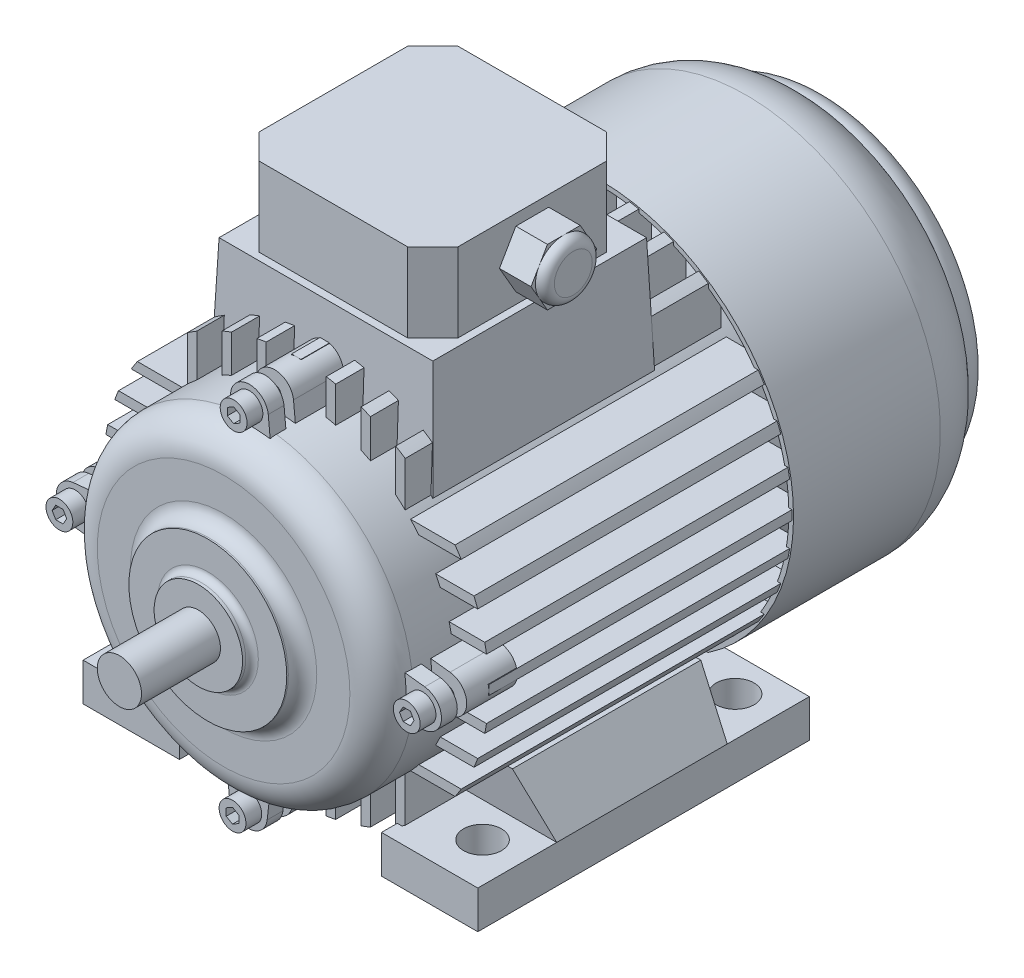
from build123d import *

# Parameters (mm, degrees)
BOSS_EXTRUDE1_DEPTH          = 50
BOSS_EXTRUDE2_DEPTH          = 5
SKETCH4_R                    = 4.25
BOSS_EXTRUDE3_DEPTH          = 5
CUT_EXTRUDE1_DEPTH           = 4
SKETCH6_R                    = 2
BOSS_EXTRUDE4_DEPTH          = 3
BOSS_EXTRUDE6_DEPTH          = 16
CIRPATTERN1_COUNT            = 4
SKETCH10_W                   = 7.5
SKETCH10_H                   = 7.5
CUT_EXTRUDE2_DEPTH           = 2
LPATTERN1_COUNT              = 4
LPATTERN1_PITCH              = 10
LPATTERN1_COUNT_DIR2         = 4
LPATTERN1_PITCH_DIR2         = 10
CIRPATTERN2_COPY_1_SKETCH_W  = 7.5
CIRPATTERN2_COPY_1_SKETCH_H  = 7.5
CIRPATTERN2_COPY_1_DEPTH     = 2
CIRPATTERN2_COPY_2_SKETCH_W  = 7.5
CIRPATTERN2_COPY_2_SKETCH_H  = 7.5
CIRPATTERN2_COPY_2_DEPTH     = 2
CIRPATTERN2_COPY_3_SKETCH_W  = 7.5
CIRPATTERN2_COPY_3_SKETCH_H  = 7.5
CIRPATTERN2_COPY_3_DEPTH     = 2
CIRPATTERN2_COPY_4_SKETCH_W  = 7.5
CIRPATTERN2_COPY_4_SKETCH_H  = 7.5
CIRPATTERN2_COPY_4_DEPTH     = 2
CIRPATTERN2_COPY_5_SKETCH_W  = 7.5
CIRPATTERN2_COPY_5_SKETCH_H  = 7.5
CIRPATTERN2_COPY_5_DEPTH     = 2
CIRPATTERN2_COPY_6_SKETCH_W  = 7.5
CIRPATTERN2_COPY_6_SKETCH_H  = 7.5
CIRPATTERN2_COPY_6_DEPTH     = 2
CIRPATTERN2_COPY_7_SKETCH_W  = 7.5
CIRPATTERN2_COPY_7_SKETCH_H  = 7.5
CIRPATTERN2_COPY_7_DEPTH     = 2
CIRPATTERN2_COPY_8_SKETCH_W  = 7.5
CIRPATTERN2_COPY_8_SKETCH_H  = 7.5
CIRPATTERN2_COPY_8_DEPTH     = 2
CIRPATTERN2_COPY_9_SKETCH_W  = 7.5
CIRPATTERN2_COPY_9_SKETCH_H  = 7.5
CIRPATTERN2_COPY_9_DEPTH     = 2
CIRPATTERN2_COPY_10_SKETCH_W = 7.5
CIRPATTERN2_COPY_10_SKETCH_H = 7.5
CIRPATTERN2_COPY_10_DEPTH    = 2
CIRPATTERN2_COPY_11_SKETCH_W = 7.5
CIRPATTERN2_COPY_11_SKETCH_H = 7.5
CIRPATTERN2_COPY_11_DEPTH    = 2
CIRPATTERN2_COPY_12_SKETCH_W = 7.5
CIRPATTERN2_COPY_12_SKETCH_H = 7.5
CIRPATTERN2_COPY_12_DEPTH    = 2
CIRPATTERN2_COPY_13_SKETCH_W = 7.5
CIRPATTERN2_COPY_13_SKETCH_H = 7.5
CIRPATTERN2_COPY_13_DEPTH    = 2
CIRPATTERN2_COPY_14_SKETCH_W = 7.5
CIRPATTERN2_COPY_14_SKETCH_H = 7.5
CIRPATTERN2_COPY_14_DEPTH    = 2
CIRPATTERN2_COPY_15_SKETCH_W = 7.5
CIRPATTERN2_COPY_15_SKETCH_H = 7.5
CIRPATTERN2_COPY_15_DEPTH    = 2
CIRPATTERN2_COPY_16_SKETCH_W = 7.5
CIRPATTERN2_COPY_16_SKETCH_H = 7.5
CIRPATTERN2_COPY_16_DEPTH    = 2
CIRPATTERN2_COPY_17_SKETCH_W = 7.5
CIRPATTERN2_COPY_17_SKETCH_H = 7.5
CIRPATTERN2_COPY_17_DEPTH    = 2
CIRPATTERN2_COPY_18_SKETCH_W = 7.5
CIRPATTERN2_COPY_18_SKETCH_H = 7.5
CIRPATTERN2_COPY_18_DEPTH    = 2
CIRPATTERN2_COPY_19_SKETCH_W = 7.5
CIRPATTERN2_COPY_19_SKETCH_H = 7.5
CIRPATTERN2_COPY_19_DEPTH    = 2
CIRPATTERN2_COPY_20_SKETCH_W = 7.5
CIRPATTERN2_COPY_20_SKETCH_H = 7.5
CIRPATTERN2_COPY_20_DEPTH    = 2
CIRPATTERN2_COPY_21_SKETCH_W = 7.5
CIRPATTERN2_COPY_21_SKETCH_H = 7.5
CIRPATTERN2_COPY_21_DEPTH    = 2
CIRPATTERN2_COPY_22_SKETCH_W = 7.5
CIRPATTERN2_COPY_22_SKETCH_H = 7.5
CIRPATTERN2_COPY_22_DEPTH    = 2
CIRPATTERN2_COPY_23_SKETCH_W = 7.5
CIRPATTERN2_COPY_23_SKETCH_H = 7.5
CIRPATTERN2_COPY_23_DEPTH    = 2
CIRPATTERN2_COPY_24_SKETCH_W = 7.5
CIRPATTERN2_COPY_24_SKETCH_H = 7.5
CIRPATTERN2_COPY_24_DEPTH    = 2
CIRPATTERN2_COPY_25_SKETCH_W = 7.5
CIRPATTERN2_COPY_25_SKETCH_H = 7.5
CIRPATTERN2_COPY_25_DEPTH    = 2
CIRPATTERN2_COPY_26_SKETCH_W = 7.5
CIRPATTERN2_COPY_26_SKETCH_H = 7.5
CIRPATTERN2_COPY_26_DEPTH    = 2
CIRPATTERN2_COPY_27_SKETCH_W = 7.5
CIRPATTERN2_COPY_27_SKETCH_H = 7.5
CIRPATTERN2_COPY_27_DEPTH    = 2
CIRPATTERN2_COPY_28_SKETCH_W = 7.5
CIRPATTERN2_COPY_28_SKETCH_H = 7.5
CIRPATTERN2_COPY_28_DEPTH    = 2
CIRPATTERN2_COPY_29_SKETCH_W = 7.5
CIRPATTERN2_COPY_29_SKETCH_H = 7.5
CIRPATTERN2_COPY_29_DEPTH    = 2
CIRPATTERN2_COPY_30_SKETCH_W = 7.5
CIRPATTERN2_COPY_30_SKETCH_H = 7.5
CIRPATTERN2_COPY_30_DEPTH    = 2
CIRPATTERN2_COPY_31_SKETCH_W = 7.5
CIRPATTERN2_COPY_31_SKETCH_H = 7.5
CIRPATTERN2_COPY_31_DEPTH    = 2
CIRPATTERN2_COPY_32_SKETCH_W = 7.5
CIRPATTERN2_COPY_32_SKETCH_H = 7.5
CIRPATTERN2_COPY_32_DEPTH    = 2
CIRPATTERN2_COPY_33_SKETCH_W = 7.5
CIRPATTERN2_COPY_33_SKETCH_H = 7.5
CIRPATTERN2_COPY_33_DEPTH    = 2
CIRPATTERN2_COPY_34_SKETCH_W = 7.5
CIRPATTERN2_COPY_34_SKETCH_H = 7.5
CIRPATTERN2_COPY_34_DEPTH    = 2
CIRPATTERN2_COPY_35_SKETCH_W = 7.5
CIRPATTERN2_COPY_35_SKETCH_H = 7.5
CIRPATTERN2_COPY_35_DEPTH    = 2
CIRPATTERN2_COPY_36_SKETCH_W = 7.5
CIRPATTERN2_COPY_36_SKETCH_H = 7.5
CIRPATTERN2_COPY_36_DEPTH    = 2
CIRPATTERN2_COPY_37_SKETCH_W = 7.5
CIRPATTERN2_COPY_37_SKETCH_H = 7.5
CIRPATTERN2_COPY_37_DEPTH    = 2
CIRPATTERN2_COPY_38_SKETCH_W = 7.5
CIRPATTERN2_COPY_38_SKETCH_H = 7.5
CIRPATTERN2_COPY_38_DEPTH    = 2
CIRPATTERN2_COPY_39_SKETCH_W = 7.5
CIRPATTERN2_COPY_39_SKETCH_H = 7.5
CIRPATTERN2_COPY_39_DEPTH    = 2
CIRPATTERN2_COPY_40_SKETCH_W = 7.5
CIRPATTERN2_COPY_40_SKETCH_H = 7.5
CIRPATTERN2_COPY_40_DEPTH    = 2
CIRPATTERN2_COPY_41_SKETCH_W = 7.5
CIRPATTERN2_COPY_41_SKETCH_H = 7.5
CIRPATTERN2_COPY_41_DEPTH    = 2
CIRPATTERN2_COPY_42_SKETCH_W = 7.5
CIRPATTERN2_COPY_42_SKETCH_H = 7.5
CIRPATTERN2_COPY_42_DEPTH    = 2
CIRPATTERN2_COPY_43_SKETCH_W = 7.5
CIRPATTERN2_COPY_43_SKETCH_H = 7.5
CIRPATTERN2_COPY_43_DEPTH    = 2
CIRPATTERN2_COPY_44_SKETCH_W = 7.5
CIRPATTERN2_COPY_44_SKETCH_H = 7.5
CIRPATTERN2_COPY_44_DEPTH    = 2
CIRPATTERN2_COPY_45_SKETCH_W = 7.5
CIRPATTERN2_COPY_45_SKETCH_H = 7.5
CIRPATTERN2_COPY_45_DEPTH    = 2
SKETCH11_W                   = 30
SKETCH11_H                   = 54
BOSS_EXTRUDE7_DEPTH          = 16
DRAFT1_ANGLE                 = -35
DRAFT2_ANGLE                 = 10
SKETCH12_W                   = 30.5
SKETCH12_H                   = 27
BOSS_EXTRUDE8_DEPTH          = 12
SKETCH13_W                   = 4
SKETCH13_H                   = 51
BOSS_EXTRUDE9_DEPTH          = 12
SKETCH14_R                   = 6
CUT_EXTRUDE3_DEPTH           = 12
SKETCH15_W                   = 70.5
SKETCH15_H                   = 70.5
BOSS_EXTRUDE10_DEPTH         = 40.23
BOSS_EXTRUDE10_TAPER         = 2
BOSS_EXTRUDE11_DEPTH         = 25
BOSS_EXTRUDE12_DEPTH         = 10
SKETCH18_R                   = 9
BOSS_EXTRUDE13_DEPTH         = 3
FILLET1_R                    = 3
BOSS_EXTRUDE14_START         = 50
SKETCH22_R                   = 7
BOSS_EXTRUDE14_DEPTH         = 50


with BuildPart() as part:
    # Sketch1 → Revolve1 (revolve)
    with BuildSketch(Plane(origin=(0, 0, 0), x_dir=(0, 0, -1), z_dir=(1, 0, 0)), mode=Mode.PRIVATE) as revolve1_sk:
        with BuildLine():
            Line((0, 7), (0, 14))
            Line((0, 14), (1, 14))
            ThreePointArc((1, 14), (2.414213562, 14.585786438), (3, 16))
            Line((3, 16), (3, 25))
            Line((3, 25), (3.5, 25))
            ThreePointArc((3.5, 25), (6.681980515, 26.318019485), (8, 29.5))
            Line((8, 29.5), (8, 40))
            ThreePointArc((8, 40), (10.928932188, 47.071067812), (18, 50))
            Line((18, 50), (142, 50))
            ThreePointArc((142, 50), (149.071067812, 47.071067812), (152, 40))
            Line((152, 40), (152, 0))
            Line((152, 0), (25, 0))
            Line((25, 0), (25, 7))
            Line((25, 7), (0, 7))
        make_face()
    revolve(revolve1_sk.sketch.rotate(Axis((0, 0, 0), (0, 0, -1)), 90), axis=Axis((0, 0, 0), (0, 0, -1)))

    # Sketch2 → Boss-Extrude1 (add, symmetric)
    with BuildSketch(Plane(origin=(0, 0, -81), x_dir=(-1, 0, 0), z_dir=(0, 0, -1))):
        with BuildLine():
            Line((-60.981554588, -1.5), (-49.977494935, -1.5))
            ThreePointArc((-49.977494935, -1.5), (-50, 0), (-49.977494935, 1.5))
            Line((-49.977494935, 1.5), (-60.981554588, 1.5))
            ThreePointArc((-60.981554588, 1.5), (-61, 0), (-60.981554588, -1.5))
        make_face()
        with BuildLine():
            Line((-60.255705124, 9.5), (-49.089204516, 9.5))
            ThreePointArc((-49.089204516, 9.5), (-48.773819281, 11.005205709), (-48.412291828, 12.5))
            Line((-48.412291828, 12.5), (-59.705527382, 12.5))
            ThreePointArc((-59.705527382, 12.5), (-59.999369381, 11.003439184), (-60.255705124, 9.5))
        make_face()
        with BuildLine():
            Line((-57.452154007, 20.5), (-45.604276115, 20.5))
            ThreePointArc((-45.604276115, 20.5), (-44.893864532, 22.012290372), (-44.133320745, 23.5))
            Line((-44.133320745, 23.5), (-56.291651246, 23.5))
            ThreePointArc((-56.291651246, 23.5), (-56.891680484, 22.007650753), (-57.452154007, 20.5))
        make_face()
        with BuildLine():
            Line((-52.237438681, 31.5), (-38.829756631, 31.5))
            ThreePointArc((-38.829756631, 31.5), (-37.540092426, 33.026375227), (-36.190468358, 34.5))
            Line((-36.190468358, 34.5), (-50.306560208, 34.5))
            ThreePointArc((-50.306560208, 34.5), (-51.293936553, 33.014119296), (-52.237438681, 31.5))
        make_face()
        with BuildLine():
            Line((-50.306560208, -34.5), (-36.190468358, -34.5))
            ThreePointArc((-36.190468358, -34.5), (-37.540092426, -33.026375227), (-38.829756631, -31.5))
            Line((-38.829756631, -31.5), (-52.237438681, -31.5))
            ThreePointArc((-52.237438681, -31.5), (-51.293936553, -33.014119296), (-50.306560208, -34.5))
        make_face()
        with BuildLine():
            Line((-56.291651246, -23.5), (-44.133320745, -23.5))
            ThreePointArc((-44.133320745, -23.5), (-44.893864532, -22.012290372), (-45.604276115, -20.5))
            Line((-45.604276115, -20.5), (-57.452154007, -20.5))
            ThreePointArc((-57.452154007, -20.5), (-56.891680484, -22.007650753), (-56.291651246, -23.5))
        make_face()
        with BuildLine():
            Line((-59.705527382, -12.5), (-48.412291828, -12.5))
            ThreePointArc((-48.412291828, -12.5), (-48.773819281, -11.005205709), (-49.089204516, -9.5))
            Line((-49.089204516, -9.5), (-60.255705124, -9.5))
            ThreePointArc((-60.255705124, -9.5), (-59.999369381, -11.003439184), (-59.705527382, -12.5))
        make_face()
    boss_extrude1 = extrude(amount=BOSS_EXTRUDE1_DEPTH, both=True)

    # Sketch3 → Boss-Extrude2 (add)
    with BuildSketch(Plane.XY.offset(-16)):
        with BuildLine():
            Line((-5.783916004, 55.696874367), (-7.70791108, 39.2503262))
            ThreePointArc((-7.70791108, 39.2503262), (0, 40), (7.70791108, 39.2503262))
            Line((7.70791108, 39.2503262), (6.134804738, 55.696874367))
            ThreePointArc((6.134804738, 55.696874367), (0.175444367, 60.999720175), (-5.783916004, 55.696874367))
        make_face()
    boss_extrude2 = extrude(amount=-BOSS_EXTRUDE2_DEPTH)

    # Sketch4 → Boss-Extrude3 (add)
    with BuildSketch(Plane.XY.offset(-16)):
        with Locations((0.175444367, 54.999720175)):
            Circle(SKETCH4_R)
    boss_extrude3 = extrude(amount=BOSS_EXTRUDE3_DEPTH)

    # Sketch5 → Cut-Extrude1 (cut)
    with BuildSketch(Plane.XY.offset(-11)):
        Polygon((0.175444367, 57.309121251), (-1.824555633, 56.154420713), (-1.824555633, 53.845019636), (0.175444367, 52.690319098), (2.175444367, 53.845019636), (2.175444367, 56.154420713), align=None)
    cut_extrude1 = extrude(amount=-CUT_EXTRUDE1_DEPTH, mode=Mode.SUBTRACT)

    # Sketch6 → Boss-Extrude4 (add)
    with BuildSketch(Plane(origin=(0, 0, -21), x_dir=(-1, 0, 0), z_dir=(0, 0, -1))):
        with Locations(Location((-0.175444367, 54.999720175, 0), (0, 0, 180))):
            Circle(SKETCH6_R)
    boss_extrude4 = extrude(amount=BOSS_EXTRUDE4_DEPTH)

    # Sketch8 → Boss-Extrude6 (add)
    with BuildSketch(Plane(origin=(0, 0, -24), x_dir=(-1, 0, 0), z_dir=(0, 0, -1))):
        with BuildLine():
            Line((-6.134804738, 55.696874367), (-6.723140126, 49.545932092))
            ThreePointArc((-6.723140126, 49.545932092), (-0.112558458, 49.999873306), (6.5, 49.575699692))
            Line((6.5, 49.575699692), (5.783916004, 55.696874367))
            ThreePointArc((5.783916004, 55.696874367), (-0.175444367, 60.999720175), (-6.134804738, 55.696874367))
        make_face()
    boss_extrude6 = extrude(amount=BOSS_EXTRUDE6_DEPTH)

    # CirPattern1: Boss-Extrude1, Boss-Extrude2, Boss-Extrude3, Cut-Extrude1, Boss-Extrude4, Boss-Extrude6 ×4 about axis
    cirpattern1_axis = Axis((0, 0, 0), (0, 0, 1))
    add([boss_extrude1.rotate(cirpattern1_axis, i * 360 / CIRPATTERN1_COUNT) for i in range(1, CIRPATTERN1_COUNT)])
    add([boss_extrude2.rotate(cirpattern1_axis, i * 360 / CIRPATTERN1_COUNT) for i in range(1, CIRPATTERN1_COUNT)])
    add([boss_extrude3.rotate(cirpattern1_axis, i * 360 / CIRPATTERN1_COUNT) for i in range(1, CIRPATTERN1_COUNT)])
    add([cut_extrude1.rotate(cirpattern1_axis, i * 360 / CIRPATTERN1_COUNT) for i in range(1, CIRPATTERN1_COUNT)], mode=Mode.SUBTRACT)
    add([boss_extrude4.rotate(cirpattern1_axis, i * 360 / CIRPATTERN1_COUNT) for i in range(1, CIRPATTERN1_COUNT)])
    add([boss_extrude6.rotate(cirpattern1_axis, i * 360 / CIRPATTERN1_COUNT) for i in range(1, CIRPATTERN1_COUNT)])

    # Sketch9 → Revolve2 (revolve)
    with BuildSketch(Plane(origin=(0, 0, 0), x_dir=(1, 0, 0), z_dir=(0, 1, 0)), mode=Mode.PRIVATE) as revolve2_sk:
        with BuildLine():
            Line((60, 127), (60, 173.498199465))
            ThreePointArc((60, 173.498199465), (57.381468172, 183.391862296), (50.21154358, 190.694838024))
            ThreePointArc((50.21154358, 190.694838024), (48.429764718, 196.350623659), (42.5, 196.327440791))
            Line((42.5, 196.327440791), (0, 196.327440791))
            Line((0, 196.327440791), (0, 197.827440791))
            Line((0, 197.827440791), (42.039586268, 197.827440791))
            ThreePointArc((42.039586268, 197.827440791), (49.02838849, 197.759388427), (51.915386489, 191.394388021))
            ThreePointArc((51.915386489, 191.394388021), (58.952978783, 183.648795273), (61.5, 173.498199465))
            Line((61.5, 173.498199465), (61.5, 127))
            Line((61.5, 127), (60, 127))
        make_face()
    revolve(revolve2_sk.sketch.rotate(Axis((0, 0, -196.327440791), (0, 0, 1)), 180), axis=Axis((0, 0, -196.327440791), (0, 0, 1)))

    # Sketch10 → Cut-Extrude2 (cut)
    with BuildSketch(Plane(origin=(0, 0, -197.827440791), x_dir=(-1, 0, 0), z_dir=(0, 0, -1))):
        Rectangle(SKETCH10_W, SKETCH10_H)
    cut_extrude2 = extrude(amount=-CUT_EXTRUDE2_DEPTH, mode=Mode.SUBTRACT)

    # LPattern1: Cut-Extrude2 4 × 4, 1 skipped
    with Locations(*[(i * LPATTERN1_PITCH, j * LPATTERN1_PITCH_DIR2, 0) for i in range(LPATTERN1_COUNT) for j in range(LPATTERN1_COUNT_DIR2) if (i, j) not in ((0, 0), (3, 3))]):
        add(cut_extrude2, mode=Mode.SUBTRACT)

    # CirPattern2 copy 1 sketch → CirPattern2 copy 1 (cut)
    with BuildSketch(Plane(origin=(10, 0, -197.827440791), x_dir=(0, 1, 0), z_dir=(0, 0, -1))):
        Rectangle(CIRPATTERN2_COPY_1_SKETCH_W, CIRPATTERN2_COPY_1_SKETCH_H)
    extrude(amount=-CIRPATTERN2_COPY_1_DEPTH, mode=Mode.SUBTRACT)

    # CirPattern2 copy 2 sketch → CirPattern2 copy 2 (cut)
    with BuildSketch(Plane(origin=(0, -10, -197.827440791), x_dir=(1, 0, 0), z_dir=(0, 0, -1))):
        Rectangle(CIRPATTERN2_COPY_2_SKETCH_W, CIRPATTERN2_COPY_2_SKETCH_H)
    extrude(amount=-CIRPATTERN2_COPY_2_DEPTH, mode=Mode.SUBTRACT)

    # CirPattern2 copy 3 sketch → CirPattern2 copy 3 (cut)
    with BuildSketch(Plane(origin=(-10, 0, -197.827440791), x_dir=(0, -1, 0), z_dir=(0, 0, -1))):
        Rectangle(CIRPATTERN2_COPY_3_SKETCH_W, CIRPATTERN2_COPY_3_SKETCH_H)
    extrude(amount=-CIRPATTERN2_COPY_3_DEPTH, mode=Mode.SUBTRACT)

    # CirPattern2 copy 4 sketch → CirPattern2 copy 4 (cut)
    with BuildSketch(Plane(origin=(20, 0, -197.827440791), x_dir=(0, 1, 0), z_dir=(0, 0, -1))):
        Rectangle(CIRPATTERN2_COPY_4_SKETCH_W, CIRPATTERN2_COPY_4_SKETCH_H)
    extrude(amount=-CIRPATTERN2_COPY_4_DEPTH, mode=Mode.SUBTRACT)

    # CirPattern2 copy 5 sketch → CirPattern2 copy 5 (cut)
    with BuildSketch(Plane(origin=(0, -20, -197.827440791), x_dir=(1, 0, 0), z_dir=(0, 0, -1))):
        Rectangle(CIRPATTERN2_COPY_5_SKETCH_W, CIRPATTERN2_COPY_5_SKETCH_H)
    extrude(amount=-CIRPATTERN2_COPY_5_DEPTH, mode=Mode.SUBTRACT)

    # CirPattern2 copy 6 sketch → CirPattern2 copy 6 (cut)
    with BuildSketch(Plane(origin=(-20, 0, -197.827440791), x_dir=(0, -1, 0), z_dir=(0, 0, -1))):
        Rectangle(CIRPATTERN2_COPY_6_SKETCH_W, CIRPATTERN2_COPY_6_SKETCH_H)
    extrude(amount=-CIRPATTERN2_COPY_6_DEPTH, mode=Mode.SUBTRACT)

    # CirPattern2 copy 7 sketch → CirPattern2 copy 7 (cut)
    with BuildSketch(Plane(origin=(30, 0, -197.827440791), x_dir=(0, 1, 0), z_dir=(0, 0, -1))):
        Rectangle(CIRPATTERN2_COPY_7_SKETCH_W, CIRPATTERN2_COPY_7_SKETCH_H)
    extrude(amount=-CIRPATTERN2_COPY_7_DEPTH, mode=Mode.SUBTRACT)

    # CirPattern2 copy 8 sketch → CirPattern2 copy 8 (cut)
    with BuildSketch(Plane(origin=(0, -30, -197.827440791), x_dir=(1, 0, 0), z_dir=(0, 0, -1))):
        Rectangle(CIRPATTERN2_COPY_8_SKETCH_W, CIRPATTERN2_COPY_8_SKETCH_H)
    extrude(amount=-CIRPATTERN2_COPY_8_DEPTH, mode=Mode.SUBTRACT)

    # CirPattern2 copy 9 sketch → CirPattern2 copy 9 (cut)
    with BuildSketch(Plane(origin=(-30, 0, -197.827440791), x_dir=(0, -1, 0), z_dir=(0, 0, -1))):
        Rectangle(CIRPATTERN2_COPY_9_SKETCH_W, CIRPATTERN2_COPY_9_SKETCH_H)
    extrude(amount=-CIRPATTERN2_COPY_9_DEPTH, mode=Mode.SUBTRACT)

    # CirPattern2 copy 10 sketch → CirPattern2 copy 10 (cut)
    with BuildSketch(Plane(origin=(0, -10, -197.827440791), x_dir=(0, 1, 0), z_dir=(0, 0, -1))):
        Rectangle(CIRPATTERN2_COPY_10_SKETCH_W, CIRPATTERN2_COPY_10_SKETCH_H)
    extrude(amount=-CIRPATTERN2_COPY_10_DEPTH, mode=Mode.SUBTRACT)

    # CirPattern2 copy 11 sketch → CirPattern2 copy 11 (cut)
    with BuildSketch(Plane(origin=(-10, 0, -197.827440791), x_dir=(1, 0, 0), z_dir=(0, 0, -1))):
        Rectangle(CIRPATTERN2_COPY_11_SKETCH_W, CIRPATTERN2_COPY_11_SKETCH_H)
    extrude(amount=-CIRPATTERN2_COPY_11_DEPTH, mode=Mode.SUBTRACT)

    # CirPattern2 copy 12 sketch → CirPattern2 copy 12 (cut)
    with BuildSketch(Plane(origin=(0, 10, -197.827440791), x_dir=(0, -1, 0), z_dir=(0, 0, -1))):
        Rectangle(CIRPATTERN2_COPY_12_SKETCH_W, CIRPATTERN2_COPY_12_SKETCH_H)
    extrude(amount=-CIRPATTERN2_COPY_12_DEPTH, mode=Mode.SUBTRACT)

    # CirPattern2 copy 13 sketch → CirPattern2 copy 13 (cut)
    with BuildSketch(Plane(origin=(10, -10, -197.827440791), x_dir=(0, 1, 0), z_dir=(0, 0, -1))):
        Rectangle(CIRPATTERN2_COPY_13_SKETCH_W, CIRPATTERN2_COPY_13_SKETCH_H)
    extrude(amount=-CIRPATTERN2_COPY_13_DEPTH, mode=Mode.SUBTRACT)

    # CirPattern2 copy 14 sketch → CirPattern2 copy 14 (cut)
    with BuildSketch(Plane(origin=(-10, -10, -197.827440791), x_dir=(1, 0, 0), z_dir=(0, 0, -1))):
        Rectangle(CIRPATTERN2_COPY_14_SKETCH_W, CIRPATTERN2_COPY_14_SKETCH_H)
    extrude(amount=-CIRPATTERN2_COPY_14_DEPTH, mode=Mode.SUBTRACT)

    # CirPattern2 copy 15 sketch → CirPattern2 copy 15 (cut)
    with BuildSketch(Plane(origin=(-10, 10, -197.827440791), x_dir=(0, -1, 0), z_dir=(0, 0, -1))):
        Rectangle(CIRPATTERN2_COPY_15_SKETCH_W, CIRPATTERN2_COPY_15_SKETCH_H)
    extrude(amount=-CIRPATTERN2_COPY_15_DEPTH, mode=Mode.SUBTRACT)

    # CirPattern2 copy 16 sketch → CirPattern2 copy 16 (cut)
    with BuildSketch(Plane(origin=(20, -10, -197.827440791), x_dir=(0, 1, 0), z_dir=(0, 0, -1))):
        Rectangle(CIRPATTERN2_COPY_16_SKETCH_W, CIRPATTERN2_COPY_16_SKETCH_H)
    extrude(amount=-CIRPATTERN2_COPY_16_DEPTH, mode=Mode.SUBTRACT)

    # CirPattern2 copy 17 sketch → CirPattern2 copy 17 (cut)
    with BuildSketch(Plane(origin=(-10, -20, -197.827440791), x_dir=(1, 0, 0), z_dir=(0, 0, -1))):
        Rectangle(CIRPATTERN2_COPY_17_SKETCH_W, CIRPATTERN2_COPY_17_SKETCH_H)
    extrude(amount=-CIRPATTERN2_COPY_17_DEPTH, mode=Mode.SUBTRACT)

    # CirPattern2 copy 18 sketch → CirPattern2 copy 18 (cut)
    with BuildSketch(Plane(origin=(-20, 10, -197.827440791), x_dir=(0, -1, 0), z_dir=(0, 0, -1))):
        Rectangle(CIRPATTERN2_COPY_18_SKETCH_W, CIRPATTERN2_COPY_18_SKETCH_H)
    extrude(amount=-CIRPATTERN2_COPY_18_DEPTH, mode=Mode.SUBTRACT)

    # CirPattern2 copy 19 sketch → CirPattern2 copy 19 (cut)
    with BuildSketch(Plane(origin=(30, -10, -197.827440791), x_dir=(0, 1, 0), z_dir=(0, 0, -1))):
        Rectangle(CIRPATTERN2_COPY_19_SKETCH_W, CIRPATTERN2_COPY_19_SKETCH_H)
    extrude(amount=-CIRPATTERN2_COPY_19_DEPTH, mode=Mode.SUBTRACT)

    # CirPattern2 copy 20 sketch → CirPattern2 copy 20 (cut)
    with BuildSketch(Plane(origin=(-10, -30, -197.827440791), x_dir=(1, 0, 0), z_dir=(0, 0, -1))):
        Rectangle(CIRPATTERN2_COPY_20_SKETCH_W, CIRPATTERN2_COPY_20_SKETCH_H)
    extrude(amount=-CIRPATTERN2_COPY_20_DEPTH, mode=Mode.SUBTRACT)

    # CirPattern2 copy 21 sketch → CirPattern2 copy 21 (cut)
    with BuildSketch(Plane(origin=(-30, 10, -197.827440791), x_dir=(0, -1, 0), z_dir=(0, 0, -1))):
        Rectangle(CIRPATTERN2_COPY_21_SKETCH_W, CIRPATTERN2_COPY_21_SKETCH_H)
    extrude(amount=-CIRPATTERN2_COPY_21_DEPTH, mode=Mode.SUBTRACT)

    # CirPattern2 copy 22 sketch → CirPattern2 copy 22 (cut)
    with BuildSketch(Plane(origin=(0, -20, -197.827440791), x_dir=(0, 1, 0), z_dir=(0, 0, -1))):
        Rectangle(CIRPATTERN2_COPY_22_SKETCH_W, CIRPATTERN2_COPY_22_SKETCH_H)
    extrude(amount=-CIRPATTERN2_COPY_22_DEPTH, mode=Mode.SUBTRACT)

    # CirPattern2 copy 23 sketch → CirPattern2 copy 23 (cut)
    with BuildSketch(Plane(origin=(-20, 0, -197.827440791), x_dir=(1, 0, 0), z_dir=(0, 0, -1))):
        Rectangle(CIRPATTERN2_COPY_23_SKETCH_W, CIRPATTERN2_COPY_23_SKETCH_H)
    extrude(amount=-CIRPATTERN2_COPY_23_DEPTH, mode=Mode.SUBTRACT)

    # CirPattern2 copy 24 sketch → CirPattern2 copy 24 (cut)
    with BuildSketch(Plane(origin=(0, 20, -197.827440791), x_dir=(0, -1, 0), z_dir=(0, 0, -1))):
        Rectangle(CIRPATTERN2_COPY_24_SKETCH_W, CIRPATTERN2_COPY_24_SKETCH_H)
    extrude(amount=-CIRPATTERN2_COPY_24_DEPTH, mode=Mode.SUBTRACT)

    # CirPattern2 copy 25 sketch → CirPattern2 copy 25 (cut)
    with BuildSketch(Plane(origin=(10, -20, -197.827440791), x_dir=(0, 1, 0), z_dir=(0, 0, -1))):
        Rectangle(CIRPATTERN2_COPY_25_SKETCH_W, CIRPATTERN2_COPY_25_SKETCH_H)
    extrude(amount=-CIRPATTERN2_COPY_25_DEPTH, mode=Mode.SUBTRACT)

    # CirPattern2 copy 26 sketch → CirPattern2 copy 26 (cut)
    with BuildSketch(Plane(origin=(-20, -10, -197.827440791), x_dir=(1, 0, 0), z_dir=(0, 0, -1))):
        Rectangle(CIRPATTERN2_COPY_26_SKETCH_W, CIRPATTERN2_COPY_26_SKETCH_H)
    extrude(amount=-CIRPATTERN2_COPY_26_DEPTH, mode=Mode.SUBTRACT)

    # CirPattern2 copy 27 sketch → CirPattern2 copy 27 (cut)
    with BuildSketch(Plane(origin=(-10, 20, -197.827440791), x_dir=(0, -1, 0), z_dir=(0, 0, -1))):
        Rectangle(CIRPATTERN2_COPY_27_SKETCH_W, CIRPATTERN2_COPY_27_SKETCH_H)
    extrude(amount=-CIRPATTERN2_COPY_27_DEPTH, mode=Mode.SUBTRACT)

    # CirPattern2 copy 28 sketch → CirPattern2 copy 28 (cut)
    with BuildSketch(Plane(origin=(20, -20, -197.827440791), x_dir=(0, 1, 0), z_dir=(0, 0, -1))):
        Rectangle(CIRPATTERN2_COPY_28_SKETCH_W, CIRPATTERN2_COPY_28_SKETCH_H)
    extrude(amount=-CIRPATTERN2_COPY_28_DEPTH, mode=Mode.SUBTRACT)

    # CirPattern2 copy 29 sketch → CirPattern2 copy 29 (cut)
    with BuildSketch(Plane(origin=(-20, -20, -197.827440791), x_dir=(1, 0, 0), z_dir=(0, 0, -1))):
        Rectangle(CIRPATTERN2_COPY_29_SKETCH_W, CIRPATTERN2_COPY_29_SKETCH_H)
    extrude(amount=-CIRPATTERN2_COPY_29_DEPTH, mode=Mode.SUBTRACT)

    # CirPattern2 copy 30 sketch → CirPattern2 copy 30 (cut)
    with BuildSketch(Plane(origin=(-20, 20, -197.827440791), x_dir=(0, -1, 0), z_dir=(0, 0, -1))):
        Rectangle(CIRPATTERN2_COPY_30_SKETCH_W, CIRPATTERN2_COPY_30_SKETCH_H)
    extrude(amount=-CIRPATTERN2_COPY_30_DEPTH, mode=Mode.SUBTRACT)

    # CirPattern2 copy 31 sketch → CirPattern2 copy 31 (cut)
    with BuildSketch(Plane(origin=(30, -20, -197.827440791), x_dir=(0, 1, 0), z_dir=(0, 0, -1))):
        Rectangle(CIRPATTERN2_COPY_31_SKETCH_W, CIRPATTERN2_COPY_31_SKETCH_H)
    extrude(amount=-CIRPATTERN2_COPY_31_DEPTH, mode=Mode.SUBTRACT)

    # CirPattern2 copy 32 sketch → CirPattern2 copy 32 (cut)
    with BuildSketch(Plane(origin=(-20, -30, -197.827440791), x_dir=(1, 0, 0), z_dir=(0, 0, -1))):
        Rectangle(CIRPATTERN2_COPY_32_SKETCH_W, CIRPATTERN2_COPY_32_SKETCH_H)
    extrude(amount=-CIRPATTERN2_COPY_32_DEPTH, mode=Mode.SUBTRACT)

    # CirPattern2 copy 33 sketch → CirPattern2 copy 33 (cut)
    with BuildSketch(Plane(origin=(-30, 20, -197.827440791), x_dir=(0, -1, 0), z_dir=(0, 0, -1))):
        Rectangle(CIRPATTERN2_COPY_33_SKETCH_W, CIRPATTERN2_COPY_33_SKETCH_H)
    extrude(amount=-CIRPATTERN2_COPY_33_DEPTH, mode=Mode.SUBTRACT)

    # CirPattern2 copy 34 sketch → CirPattern2 copy 34 (cut)
    with BuildSketch(Plane(origin=(0, -30, -197.827440791), x_dir=(0, 1, 0), z_dir=(0, 0, -1))):
        Rectangle(CIRPATTERN2_COPY_34_SKETCH_W, CIRPATTERN2_COPY_34_SKETCH_H)
    extrude(amount=-CIRPATTERN2_COPY_34_DEPTH, mode=Mode.SUBTRACT)

    # CirPattern2 copy 35 sketch → CirPattern2 copy 35 (cut)
    with BuildSketch(Plane(origin=(-30, 0, -197.827440791), x_dir=(1, 0, 0), z_dir=(0, 0, -1))):
        Rectangle(CIRPATTERN2_COPY_35_SKETCH_W, CIRPATTERN2_COPY_35_SKETCH_H)
    extrude(amount=-CIRPATTERN2_COPY_35_DEPTH, mode=Mode.SUBTRACT)

    # CirPattern2 copy 36 sketch → CirPattern2 copy 36 (cut)
    with BuildSketch(Plane(origin=(0, 30, -197.827440791), x_dir=(0, -1, 0), z_dir=(0, 0, -1))):
        Rectangle(CIRPATTERN2_COPY_36_SKETCH_W, CIRPATTERN2_COPY_36_SKETCH_H)
    extrude(amount=-CIRPATTERN2_COPY_36_DEPTH, mode=Mode.SUBTRACT)

    # CirPattern2 copy 37 sketch → CirPattern2 copy 37 (cut)
    with BuildSketch(Plane(origin=(10, -30, -197.827440791), x_dir=(0, 1, 0), z_dir=(0, 0, -1))):
        Rectangle(CIRPATTERN2_COPY_37_SKETCH_W, CIRPATTERN2_COPY_37_SKETCH_H)
    extrude(amount=-CIRPATTERN2_COPY_37_DEPTH, mode=Mode.SUBTRACT)

    # CirPattern2 copy 38 sketch → CirPattern2 copy 38 (cut)
    with BuildSketch(Plane(origin=(-30, -10, -197.827440791), x_dir=(1, 0, 0), z_dir=(0, 0, -1))):
        Rectangle(CIRPATTERN2_COPY_38_SKETCH_W, CIRPATTERN2_COPY_38_SKETCH_H)
    extrude(amount=-CIRPATTERN2_COPY_38_DEPTH, mode=Mode.SUBTRACT)

    # CirPattern2 copy 39 sketch → CirPattern2 copy 39 (cut)
    with BuildSketch(Plane(origin=(-10, 30, -197.827440791), x_dir=(0, -1, 0), z_dir=(0, 0, -1))):
        Rectangle(CIRPATTERN2_COPY_39_SKETCH_W, CIRPATTERN2_COPY_39_SKETCH_H)
    extrude(amount=-CIRPATTERN2_COPY_39_DEPTH, mode=Mode.SUBTRACT)

    # CirPattern2 copy 40 sketch → CirPattern2 copy 40 (cut)
    with BuildSketch(Plane(origin=(20, -30, -197.827440791), x_dir=(0, 1, 0), z_dir=(0, 0, -1))):
        Rectangle(CIRPATTERN2_COPY_40_SKETCH_W, CIRPATTERN2_COPY_40_SKETCH_H)
    extrude(amount=-CIRPATTERN2_COPY_40_DEPTH, mode=Mode.SUBTRACT)

    # CirPattern2 copy 41 sketch → CirPattern2 copy 41 (cut)
    with BuildSketch(Plane(origin=(-30, -20, -197.827440791), x_dir=(1, 0, 0), z_dir=(0, 0, -1))):
        Rectangle(CIRPATTERN2_COPY_41_SKETCH_W, CIRPATTERN2_COPY_41_SKETCH_H)
    extrude(amount=-CIRPATTERN2_COPY_41_DEPTH, mode=Mode.SUBTRACT)

    # CirPattern2 copy 42 sketch → CirPattern2 copy 42 (cut)
    with BuildSketch(Plane(origin=(-20, 30, -197.827440791), x_dir=(0, -1, 0), z_dir=(0, 0, -1))):
        Rectangle(CIRPATTERN2_COPY_42_SKETCH_W, CIRPATTERN2_COPY_42_SKETCH_H)
    extrude(amount=-CIRPATTERN2_COPY_42_DEPTH, mode=Mode.SUBTRACT)

    # CirPattern2 copy 43 sketch → CirPattern2 copy 43 (cut)
    with BuildSketch(Plane.YX.offset(197.827440791)):
        Rectangle(CIRPATTERN2_COPY_43_SKETCH_W, CIRPATTERN2_COPY_43_SKETCH_H)
    extrude(amount=-CIRPATTERN2_COPY_43_DEPTH, mode=Mode.SUBTRACT)

    # CirPattern2 copy 44 sketch → CirPattern2 copy 44 (cut)
    with BuildSketch(Plane(origin=(0, 0, -197.827440791), x_dir=(1, 0, 0), z_dir=(0, 0, -1))):
        Rectangle(CIRPATTERN2_COPY_44_SKETCH_W, CIRPATTERN2_COPY_44_SKETCH_H)
    extrude(amount=-CIRPATTERN2_COPY_44_DEPTH, mode=Mode.SUBTRACT)

    # CirPattern2 copy 45 sketch → CirPattern2 copy 45 (cut)
    with BuildSketch(Plane(origin=(0, 0, -197.827440791), x_dir=(0, -1, 0), z_dir=(0, 0, -1))):
        Rectangle(CIRPATTERN2_COPY_45_SKETCH_W, CIRPATTERN2_COPY_45_SKETCH_H)
    extrude(amount=-CIRPATTERN2_COPY_45_DEPTH, mode=Mode.SUBTRACT)

    # Sketch11 → Boss-Extrude7 (add)
    with BuildSketch(Plane(origin=(0, -51, 0), x_dir=(1, 0, 0), z_dir=(0, 1, 0))):
        with Locations((-47.5, 78)):
            Rectangle(SKETCH11_W, SKETCH11_H)
        with Locations((47.5, 78)):
            Rectangle(SKETCH11_W, SKETCH11_H)
    extrude(amount=BOSS_EXTRUDE7_DEPTH)

    # Draft1
    draft1_faces = [part.faces().sort_by_distance(p)[0] for p in [
        (62.5, -43, -78),
        (-62.5, -43, -78),
    ]]
    draft(draft1_faces, Plane(origin=(0, -51, 0), x_dir=(0, 0, -1), z_dir=(0, -1, 0)), DRAFT1_ANGLE)

    # Draft2
    draft2_faces = [part.faces().sort_by_distance(p)[0] for p in [
        (45.94334161, -43.690753213, -105),
        (-45.94334161, -43.690753213, -105),
        (45.94334161, -43.690753213, -51),
        (-45.94334161, -43.690753213, -51),
    ]]
    draft(draft2_faces, Plane(origin=(0, -51, 0), x_dir=(0, 0, -1), z_dir=(0, -1, 0)), DRAFT2_ANGLE)

    # Sketch12 → Boss-Extrude8 (add)
    with BuildSketch(Plane(origin=(0, -51, 0), x_dir=(1, 0, 0), z_dir=(0, 1, 0))):
        with Locations((47.25, 117.5)):
            Rectangle(SKETCH12_W, SKETCH12_H)
        with Locations((-47.25, 39.5)):
            Rectangle(SKETCH12_W, SKETCH12_H)
        with Locations((47.25, 39.5)):
            Rectangle(SKETCH12_W, SKETCH12_H)
        with Locations((-47.25, 117.5)):
            Rectangle(SKETCH12_W, SKETCH12_H)
    extrude(amount=-BOSS_EXTRUDE8_DEPTH)

    # Sketch13 → Boss-Extrude9 (add)
    with BuildSketch(Plane(origin=(0, -51, 0), x_dir=(1, 0, 0), z_dir=(0, 1, 0))):
        with Locations((-60.5, 78.5)):
            Rectangle(SKETCH13_W, SKETCH13_H)
        with Locations((60.5, 78.5)):
            Rectangle(SKETCH13_W, SKETCH13_H)
    extrude(amount=-BOSS_EXTRUDE9_DEPTH)

    # Sketch14 → Cut-Extrude3 (cut)
    with BuildSketch(Plane.XZ.offset(63)):
        with Locations(Location((50, -40, 0), (0, 0, 270))):
            Circle(SKETCH14_R)
        with Locations(Location((-50, -40, 0), (0, 0, 270))):
            Circle(SKETCH14_R)
        with Locations(Location((-50, -120, 0), (0, 0, 270))):
            Circle(SKETCH14_R)
        with Locations(Location((50, -120, 0), (0, 0, 270))):
            Circle(SKETCH14_R)
    extrude(amount=-CUT_EXTRUDE3_DEPTH, mode=Mode.SUBTRACT)

    # Sketch15 → Boss-Extrude10 (add)
    with BuildSketch(Plane(origin=(0, 31.77, 0), x_dir=(1, 0, 0), z_dir=(0, 1, 0))):
        with Locations((0, 74.25)):
            Rectangle(SKETCH15_W, SKETCH15_H)
    extrude(amount=BOSS_EXTRUDE10_DEPTH, taper=BOSS_EXTRUDE10_TAPER)

    # Sketch16 → Boss-Extrude11 (add)
    with BuildSketch(Plane(origin=(0, 72, 0), x_dir=(1, 0, 0), z_dir=(0, 1, 0))):
        Polygon((-31.5, 97.75), (-23.5, 105.75), (23.5, 105.75), (31.5, 97.75), (31.5, 50.75), (23.5, 42.75), (-23.5, 42.75), (-31.5, 50.75), align=None)
    extrude(amount=BOSS_EXTRUDE11_DEPTH)

    # Sketch17 → Boss-Extrude12 (add)
    with BuildSketch(Plane(origin=(31.5, 0, 0), x_dir=(0, 0, -1), z_dir=(1, 0, 0))):
        Polygon((79.446152423, 93.5), (69.053847577, 93.5), (63.857695155, 84.5), (69.053847577, 75.5), (79.446152423, 75.5), (84.642304845, 84.5), align=None)
    extrude(amount=BOSS_EXTRUDE12_DEPTH)

    # Sketch18 → Boss-Extrude13 (add)
    with BuildSketch(Plane(origin=(41.5, 0, 0), x_dir=(0, 0, -1), z_dir=(1, 0, 0))):
        with Locations(Location((74.25, 84.5, 0), (0, 0, 150))):
            Circle(SKETCH18_R)
    extrude(amount=BOSS_EXTRUDE13_DEPTH)

    # Fillet1
    fillet1_edges = [part.edges().sort_by_distance(p)[0] for p in [
        (44.5, 80, -82.044228634),
    ]]
    fillet(fillet1_edges, radius=FILLET1_R - 0.0001)  # a hair under: the kernel refuses the full size

    # Sketch22 → Boss-Extrude14 (add)
    with BuildSketch(Plane.XY.offset(-25).offset(BOSS_EXTRUDE14_START)):
        Circle(SKETCH22_R)
    extrude(amount=-BOSS_EXTRUDE14_DEPTH)


solid = part.part
